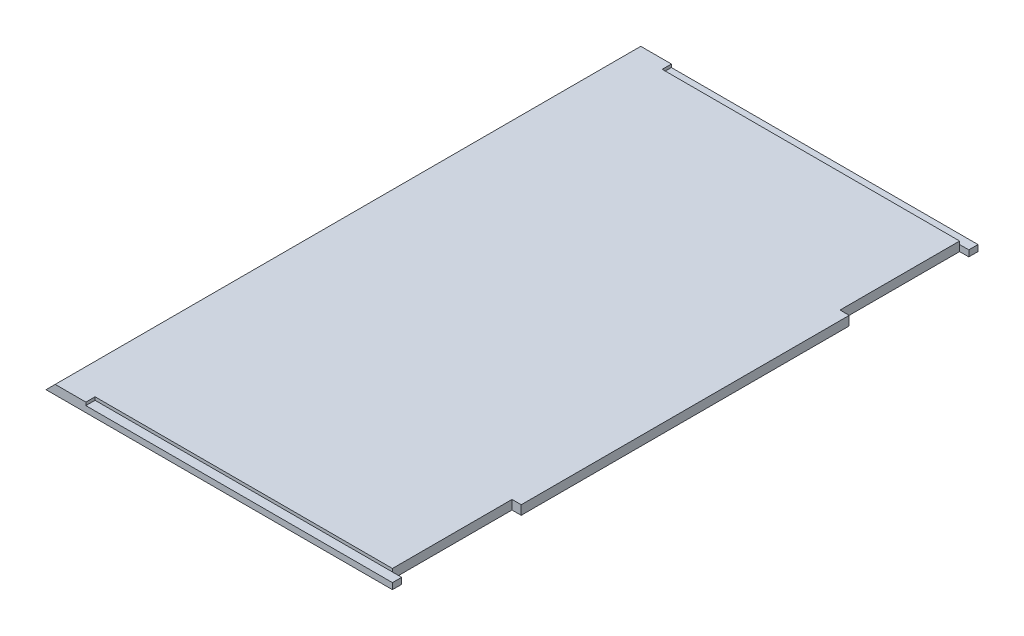
from build123d import *

# Parameters (mm, degrees)
SKETCH_1_W          = 120
SKETCH_1_H          = 191
EXTRUDE_2_DEPTH     = 3
CHAMFER_7_SIZE      = 10
SKETCH_3_W          = 100
SKETCH_3_H          = 3
CUT_EXTRUDE_4_DEPTH = 1
SKETCH_6_W          = 3.195264444
SKETCH_6_H          = 39
CUT_EXTRUDE_5_DEPTH = 196.640080888
SKETCH_8_W          = 3
SKETCH_8_H          = 39
CUT_EXTRUDE_6_DEPTH = 196.640080888


with BuildPart() as part:
    # 草图1 → 凸台-拉伸2 (new body)
    with BuildSketch(Plane(origin=(0, 0, 0), x_dir=(1, 0, 0), z_dir=(0, 1, 0))):
        with Locations((15.482452441, -84.96728408)):
            Rectangle(SKETCH_1_W, SKETCH_1_H)
    extrude(amount=EXTRUDE_2_DEPTH)

    # 倒角7
    # the kernel refuses this chamfer: 10 mm, written as the material it takes off along each edge
    with BuildSketch(Plane(origin=(-44.517547559, 3, 206.18411396), x_dir=(-0.027495876610586317, -0.9996219169112968, 0), z_dir=(0, 0, -1))) as chamfer_7_piece_1:
        Polygon((CHAMFER_7_SIZE * 0.999621916911, -CHAMFER_7_SIZE * 0.0274958766106), (-CHAMFER_7_SIZE * 0.0274958766106, -CHAMFER_7_SIZE * 0.999621916911), (0, 0), align=None)
    extrude(amount=242.433659759, mode=Mode.SUBTRACT)

    # 草图3 → 切除-拉伸4 (cut)
    with BuildSketch(Plane(origin=(0, 3, 0), x_dir=(1, 0, 0), z_dir=(0, 1, 0))):
        with Locations((25.482452441, -178.96728408)):
            Rectangle(SKETCH_3_W, SKETCH_3_H)
        with Locations((25.482452441, 9.03271592)):
            Rectangle(SKETCH_3_W, SKETCH_3_H)
    extrude(amount=-CUT_EXTRUDE_4_DEPTH, mode=Mode.SUBTRACT)

    # 草图6 → 切除-拉伸5 (cut, through all)
    with BuildSketch(Plane(origin=(0, 0, 0), x_dir=(1, 0, 0), z_dir=(0, 1, 0))):
        with Locations((74.080084663, -11.96728408)):
            Rectangle(SKETCH_6_W, SKETCH_6_H)
    extrude(amount=CUT_EXTRUDE_5_DEPTH, mode=Mode.SUBTRACT)

    # 草图8 → 切除-拉伸6 (cut, through all)
    with BuildSketch(Plane(origin=(0, 0, 0), x_dir=(1, 0, 0), z_dir=(0, 1, 0))):
        with Locations((73.982452441, -157.96728408)):
            Rectangle(SKETCH_8_W, SKETCH_8_H)
    extrude(amount=CUT_EXTRUDE_6_DEPTH, mode=Mode.SUBTRACT)


solid = part.part
